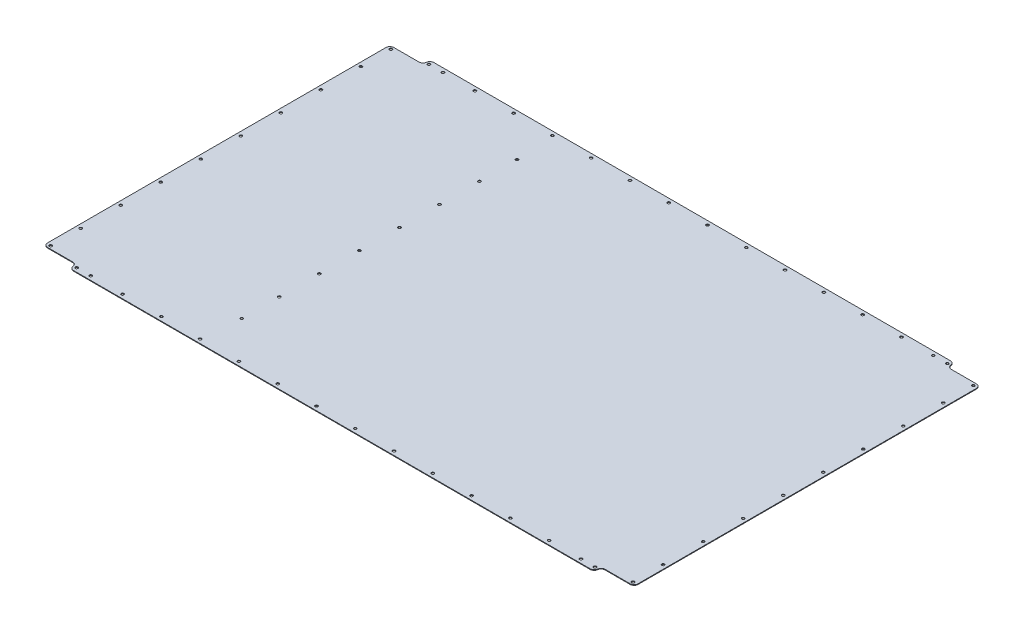
from build123d import *

# Parameters (mm, degrees)
SKETCH1_W                       = 749.3
SKETCH1_H                       = 457.2
BOSS_EXTRUDE1_DEPTH             = 0.8128
SKETCH2_W                       = 41.91
SKETCH2_H                       = 8.89
CUT_EXTRUDE1_DEPTH              = 878.771605057
FILLET1_R                       = 5.08
FILLET1_OF_MIRROR1_R            = 5.08
MIRROR2_DEPTH                   = 0.8128
F_4_CLEARANCE_HOLE1_D           = 3.4544
F_4_CLEARANCE_HOLE2_AT_2_COUNT  = 2
F_4_CLEARANCE_HOLE2_AT_2_PITCH  = 38.1
F_4_CLEARANCE_HOLE2_AT_3_COUNT  = 2
F_4_CLEARANCE_HOLE2_AT_3_PITCH  = 88.9
F_4_CLEARANCE_HOLE2_AT_4_COUNT  = 2
F_4_CLEARANCE_HOLE2_AT_4_PITCH  = 139.7
F_4_CLEARANCE_HOLE2_AT_5_COUNT  = 2
F_4_CLEARANCE_HOLE2_AT_5_PITCH  = 190.5
F_4_CLEARANCE_HOLE2_AT_6_COUNT  = 2
F_4_CLEARANCE_HOLE2_AT_6_PITCH  = 241.3
F_4_CLEARANCE_HOLE2_AT_7_COUNT  = 2
F_4_CLEARANCE_HOLE2_AT_7_PITCH  = 292.1
F_4_CLEARANCE_HOLE2_AT_8_COUNT  = 2
F_4_CLEARANCE_HOLE2_AT_8_PITCH  = 342.9
F_4_CLEARANCE_HOLE2_AT_9_COUNT  = 2
F_4_CLEARANCE_HOLE2_AT_9_PITCH  = 393.7
F_4_CLEARANCE_HOLE2_AT_10_COUNT = 2
F_4_CLEARANCE_HOLE2_AT_10_PITCH = 431.8
F_4_CLEARANCE_HOLE3_D           = 3.4544
F_4_CLEARANCE_HOLE3_DEPTH       = 0.762
F_4_CLEARANCE_HOLE3_TIP         = 1.037806461
FILLET2_R                       = 5.08


# Read off the part's stored shape, not the designer's step: Mirror2
with BuildPart() as part:
    # Sketch1 → Boss-Extrude1 (new body)
    with BuildSketch(Plane(origin=(0, 0, 0), x_dir=(1, 0, 0), z_dir=(0, 1, 0))):
        with Locations((374.65, 228.6)):
            Rectangle(SKETCH1_W, SKETCH1_H)
    extrude(amount=BOSS_EXTRUDE1_DEPTH)

    # Sketch2 → Cut-Extrude1 (cut, through all)
    with BuildSketch(Plane(origin=(0, 0.8128, 0), x_dir=(1, 0, 0), z_dir=(0, 1, 0))):
        with Locations((20.955, 452.755)):
            Rectangle(SKETCH2_W, SKETCH2_H)
    cut_extrude1 = extrude(amount=-CUT_EXTRUDE1_DEPTH, mode=Mode.SUBTRACT)

    # Fillet1
    fillet1_edges = [part.edges().sort_by_distance(p)[0] for p in [
        (41.91, 0.4064, -448.31),
    ]]
    fillet(fillet1_edges, radius=FILLET1_R)

    # Mirror1: Cut-Extrude1 across plane
    add(cut_extrude1.mirror(Plane.ZY.offset(-374.65)), mode=Mode.SUBTRACT)

    # Fillet1 of Mirror1
    fillet1_of_mirror1_edges = [part.edges().sort_by_distance(p)[0] for p in [
        (707.39, 0.4064, -448.31),
    ]]
    fillet(fillet1_of_mirror1_edges, radius=FILLET1_OF_MIRROR1_R)

    # Mirror2 outline → Mirror2 (cut)
    with BuildSketch(Plane(origin=(0, 0, 0), x_dir=(1, 0, 0), z_dir=(0, 1, 0))):
        with BuildLine():
            Line((707.39, 3.81), (707.39, 0))
            Line((707.39, 0), (749.3, 0))
            Line((749.3, 0), (749.3, 8.89))
            Line((749.3, 8.89), (712.47, 8.89))
            ThreePointArc((712.47, 8.89), (708.877897552, 7.402102448), (707.39, 3.81))
        make_face()
        with BuildLine():
            Line((41.91, 0), (41.91, 3.81))
            ThreePointArc((41.91, 3.81), (40.422102448, 7.402102448), (36.83, 8.89))
            Line((36.83, 8.89), (0, 8.89))
            Line((0, 8.89), (0, 0))
            Line((0, 0), (41.91, 0))
        make_face()
    extrude(amount=MIRROR2_DEPTH, mode=Mode.SUBTRACT)

    # #4 Clearance Hole1 (through all)
    with Locations(Plane(origin=(0, 0.8128, 0), x_dir=(-1, 0, 0), z_dir=(0, 1, 0))):
        with Locations((-45.72, -452.12), (-63.5, -452.12), (-103.98125, -452.12), (-153.19375, -452.12), (-202.40625, -452.12), (-251.61875, -452.12), (-300.83125, -452.12), (-350.04375, -452.12), (-399.25625, -452.12), (-448.46875, -452.12), (-497.68125, -452.12), (-546.89375, -452.12), (-596.10625, -452.12), (-645.31875, -452.12), (-685.8, -452.12), (-703.58, -452.12)):
            f_4_clearance_hole1 = Hole(F_4_CLEARANCE_HOLE1_D / 2)

    # Mirror3: #4 Clearance Hole1 across plane
    add(f_4_clearance_hole1.mirror(Plane(origin=(0, 0, -228.6), x_dir=(1, 0, 0), z_dir=(0, 0, -1))), mode=Mode.SUBTRACT)

    # Sketch6 → #4 Clearance Hole2 (revolve, cut)
    with BuildSketch(Plane(origin=(744.22, 0.8128, -12.7), x_dir=(0, 0, 1), z_dir=(1, 0, 0))):
        Polygon((0, 0), (0, 1.799806461), (1.7272, 0.762), (1.7272, 0), align=None)
    f_4_clearance_hole2 = revolve(axis=Axis((744.22, 7.1628, -12.7), (0, -1, 0)), mode=Mode.SUBTRACT)

    # #4 Clearance Hole2 at 2: #4 Clearance Hole2 ×2
    with Locations(*[(0, 0, -i * F_4_CLEARANCE_HOLE2_AT_2_PITCH) for i in range(1, F_4_CLEARANCE_HOLE2_AT_2_COUNT)]):
        add(f_4_clearance_hole2, mode=Mode.SUBTRACT)

    # #4 Clearance Hole2 at 3: #4 Clearance Hole2 ×2
    with Locations(*[(0, 0, -i * F_4_CLEARANCE_HOLE2_AT_3_PITCH) for i in range(1, F_4_CLEARANCE_HOLE2_AT_3_COUNT)]):
        add(f_4_clearance_hole2, mode=Mode.SUBTRACT)

    # #4 Clearance Hole2 at 4: #4 Clearance Hole2 ×2
    with Locations(*[(0, 0, -i * F_4_CLEARANCE_HOLE2_AT_4_PITCH) for i in range(1, F_4_CLEARANCE_HOLE2_AT_4_COUNT)]):
        add(f_4_clearance_hole2, mode=Mode.SUBTRACT)

    # #4 Clearance Hole2 at 5: #4 Clearance Hole2 ×2
    with Locations(*[(0, 0, -i * F_4_CLEARANCE_HOLE2_AT_5_PITCH) for i in range(1, F_4_CLEARANCE_HOLE2_AT_5_COUNT)]):
        add(f_4_clearance_hole2, mode=Mode.SUBTRACT)

    # #4 Clearance Hole2 at 6: #4 Clearance Hole2 ×2
    with Locations(*[(0, 0, -i * F_4_CLEARANCE_HOLE2_AT_6_PITCH) for i in range(1, F_4_CLEARANCE_HOLE2_AT_6_COUNT)]):
        add(f_4_clearance_hole2, mode=Mode.SUBTRACT)

    # #4 Clearance Hole2 at 7: #4 Clearance Hole2 ×2
    with Locations(*[(0, 0, -i * F_4_CLEARANCE_HOLE2_AT_7_PITCH) for i in range(1, F_4_CLEARANCE_HOLE2_AT_7_COUNT)]):
        add(f_4_clearance_hole2, mode=Mode.SUBTRACT)

    # #4 Clearance Hole2 at 8: #4 Clearance Hole2 ×2
    with Locations(*[(0, 0, -i * F_4_CLEARANCE_HOLE2_AT_8_PITCH) for i in range(1, F_4_CLEARANCE_HOLE2_AT_8_COUNT)]):
        add(f_4_clearance_hole2, mode=Mode.SUBTRACT)

    # #4 Clearance Hole2 at 9: #4 Clearance Hole2 ×2
    with Locations(*[(0, 0, -i * F_4_CLEARANCE_HOLE2_AT_9_PITCH) for i in range(1, F_4_CLEARANCE_HOLE2_AT_9_COUNT)]):
        add(f_4_clearance_hole2, mode=Mode.SUBTRACT)

    # #4 Clearance Hole2 at 10: #4 Clearance Hole2 ×2
    with Locations(*[(0, 0, -i * F_4_CLEARANCE_HOLE2_AT_10_PITCH) for i in range(1, F_4_CLEARANCE_HOLE2_AT_10_COUNT)]):
        add(f_4_clearance_hole2, mode=Mode.SUBTRACT)

    # Mirror4: #4 Clearance Hole2 across plane
    add(f_4_clearance_hole2.mirror(Plane.ZY.offset(-374.65)), mode=Mode.SUBTRACT)

    # Mirror4 copy 1 sketch → Mirror4 copy 1 (revolve, cut)
    with BuildSketch(Plane(origin=(5.08, 0.8128, -50.8), x_dir=(0, 0, 1), z_dir=(-1, 0, 0))):
        Polygon((0, 0), (0, -1.799806461), (1.7272, -0.762), (1.7272, 0), align=None)
    revolve(axis=Axis((5.08, 7.1628, -50.8), (0, 1, 0)), mode=Mode.SUBTRACT)

    # Mirror4 copy 2 sketch → Mirror4 copy 2 (revolve, cut)
    with BuildSketch(Plane(origin=(5.08, 0.8128, -101.6), x_dir=(0, 0, 1), z_dir=(-1, 0, 0))):
        Polygon((0, 0), (0, -1.799806461), (1.7272, -0.762), (1.7272, 0), align=None)
    revolve(axis=Axis((5.08, 7.1628, -101.6), (0, 1, 0)), mode=Mode.SUBTRACT)

    # Mirror4 copy 3 sketch → Mirror4 copy 3 (revolve, cut)
    with BuildSketch(Plane(origin=(5.08, 0.8128, -152.4), x_dir=(0, 0, 1), z_dir=(-1, 0, 0))):
        Polygon((0, 0), (0, -1.799806461), (1.7272, -0.762), (1.7272, 0), align=None)
    revolve(axis=Axis((5.08, 7.1628, -152.4), (0, 1, 0)), mode=Mode.SUBTRACT)

    # Mirror4 copy 4 sketch → Mirror4 copy 4 (revolve, cut)
    with BuildSketch(Plane(origin=(5.08, 0.8128, -203.2), x_dir=(0, 0, 1), z_dir=(-1, 0, 0))):
        Polygon((0, 0), (0, -1.799806461), (1.7272, -0.762), (1.7272, 0), align=None)
    revolve(axis=Axis((5.08, 7.1628, -203.2), (0, 1, 0)), mode=Mode.SUBTRACT)

    # Mirror4 copy 5 sketch → Mirror4 copy 5 (revolve, cut)
    with BuildSketch(Plane(origin=(5.08, 0.8128, -254), x_dir=(0, 0, 1), z_dir=(-1, 0, 0))):
        Polygon((0, 0), (0, -1.799806461), (1.7272, -0.762), (1.7272, 0), align=None)
    revolve(axis=Axis((5.08, 7.1628, -254), (0, 1, 0)), mode=Mode.SUBTRACT)

    # Mirror4 copy 6 sketch → Mirror4 copy 6 (revolve, cut)
    with BuildSketch(Plane(origin=(5.08, 0.8128, -304.8), x_dir=(0, 0, 1), z_dir=(-1, 0, 0))):
        Polygon((0, 0), (0, -1.799806461), (1.7272, -0.762), (1.7272, 0), align=None)
    revolve(axis=Axis((5.08, 7.1628, -304.8), (0, 1, 0)), mode=Mode.SUBTRACT)

    # Mirror4 copy 7 sketch → Mirror4 copy 7 (revolve, cut)
    with BuildSketch(Plane(origin=(5.08, 0.8128, -355.6), x_dir=(0, 0, 1), z_dir=(-1, 0, 0))):
        Polygon((0, 0), (0, -1.799806461), (1.7272, -0.762), (1.7272, 0), align=None)
    revolve(axis=Axis((5.08, 7.1628, -355.6), (0, 1, 0)), mode=Mode.SUBTRACT)

    # Mirror4 copy 8 sketch → Mirror4 copy 8 (revolve, cut)
    with BuildSketch(Plane(origin=(5.08, 0.8128, -406.4), x_dir=(0, 0, 1), z_dir=(-1, 0, 0))):
        Polygon((0, 0), (0, -1.799806461), (1.7272, -0.762), (1.7272, 0), align=None)
    revolve(axis=Axis((5.08, 7.1628, -406.4), (0, 1, 0)), mode=Mode.SUBTRACT)

    # Mirror4 copy 9 sketch → Mirror4 copy 9 (revolve, cut)
    with BuildSketch(Plane(origin=(5.08, 0.8128, -444.5), x_dir=(0, 0, 1), z_dir=(-1, 0, 0))):
        Polygon((0, 0), (0, -1.799806461), (1.7272, -0.762), (1.7272, 0), align=None)
    revolve(axis=Axis((5.08, 7.1628, -444.5), (0, 1, 0)), mode=Mode.SUBTRACT)

    # #4 Clearance Hole3
    with Locations(Plane(origin=(0, 0.8128, 0), x_dir=(-1, 0, 0), z_dir=(0, 1, 0))):
        with Locations((-206.375, -53.975), (-206.375, -101.6), (-206.375, -152.4), (-206.375, -203.2), (-206.375, -254), (-206.375, -304.8), (-206.375, -355.6), (-206.375, -403.225)):
            Hole(F_4_CLEARANCE_HOLE3_D / 2, depth=F_4_CLEARANCE_HOLE3_DEPTH)
            with Locations((0, 0, -(F_4_CLEARANCE_HOLE3_DEPTH + F_4_CLEARANCE_HOLE3_TIP / 2))):  # 118° drill point
                Cone(0, F_4_CLEARANCE_HOLE3_D / 2, F_4_CLEARANCE_HOLE3_TIP, mode=Mode.SUBTRACT)

    # Fillet2
    fillet2_edges = [part.edges().sort_by_distance(p)[0] for p in [
        (707.39, 0.4064, -457.2),
        (749.3, 0.4064, -448.31),
        (749.3, 0.4064, -8.89),
        (707.39, 0.4064, 0),
        (41.91, 0.4064, 0),
        (0, 0.4064, -8.89),
        (0, 0.4064, -448.31),
        (41.91, 0.4064, -457.2),
    ]]
    fillet(fillet2_edges, radius=FILLET2_R)


solid = part.part
